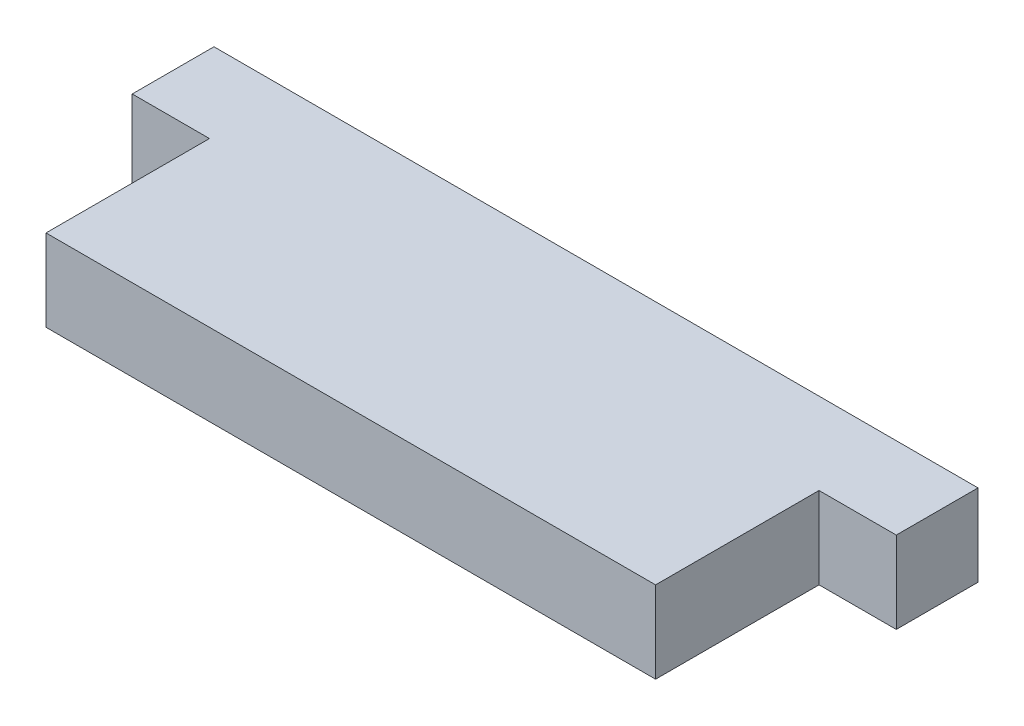
from build123d import *

# Parameters (mm, degrees)
BOSS_EXTRUDE1_DEPTH = 6.35


with BuildPart() as part:
    # Sketch1 → Boss-Extrude1 (new body)
    with BuildSketch(Plane(origin=(0, 0, 0), x_dir=(1, 0, 0), z_dir=(0, 1, 0))):
        Polygon((0, 0), (0, 12.7), (-6.0000896, 12.7), (-6.0000896, 19.05), (53.3601676, 19.05), (53.3601676, 12.7), (47.360078, 12.7), (47.360078, 0), align=None)
    extrude(amount=BOSS_EXTRUDE1_DEPTH)


solid = part.part
